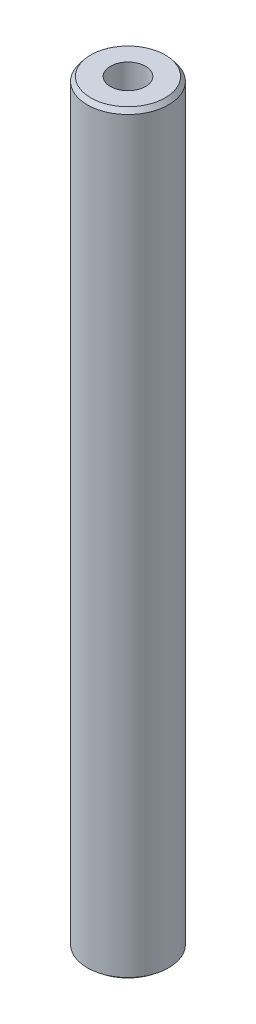
from build123d import *
from OCP.BRepFilletAPI import BRepFilletAPI_MakeChamfer

# Parameters (mm, degrees)
SKETCH1_R           = 25
BOSS_EXTRUDE1_DEPTH = 464.604287947
SKETCH2_R           = 10.821788553
CUT_EXTRUDE1_DEPTH  = 466.947576856
CHAMFER1_SIZE       = 2.671760783
CHAMFER1_SIZE2      = 2.114859868


with BuildPart() as part:
    # Sketch1 → Boss-Extrude1 (new body)
    with BuildSketch(Plane(origin=(0, 0, 0), x_dir=(1, 0, 0), z_dir=(0, 1, 0))):
        Circle(SKETCH1_R)
    extrude(amount=BOSS_EXTRUDE1_DEPTH)

    # Sketch2 → Cut-Extrude1 (cut, through all)
    with BuildSketch(Plane(origin=(0, 0, 0), x_dir=(1, 0, 0), z_dir=(0, 1, 0))):
        Circle(SKETCH2_R)
    extrude(amount=CUT_EXTRUDE1_DEPTH, mode=Mode.SUBTRACT)

    # Chamfer1: one chamfer whose edges measure the first distance from different faces: ONE call of the kernel's chamfer builder (chamfer() names one face for all edges)
    chamfer1_edges_1 = [part.edges().sort_by_distance(p)[0] for p in [
        (-25, 464.604287947, 0),
    ]]
    chamfer1_side_1 = [part.faces().sort_by_distance(p)[0] for p in [
        (-25, 232.302143973, 0),
    ]]
    chamfer1_edges_2 = [part.edges().sort_by_distance(p)[0] for p in [
        (-25, 0, 0),
    ]]
    chamfer1_side_2 = [part.faces().sort_by_distance(p)[0] for p in [
        (-24.292893219, 0, 0),
    ]]
    chamfer1 = BRepFilletAPI_MakeChamfer(part.part.solid().wrapped)
    for e in chamfer1_edges_1:
        chamfer1.Add(CHAMFER1_SIZE, CHAMFER1_SIZE2, e.wrapped, chamfer1_side_1[0].wrapped)  # the first distance lies on this face
    for e in chamfer1_edges_2:
        chamfer1.Add(CHAMFER1_SIZE, CHAMFER1_SIZE2, e.wrapped, chamfer1_side_2[0].wrapped)  # the first distance lies on this face
    add(Compound.cast(chamfer1.Shape()), mode=Mode.REPLACE)


solid = part.part
